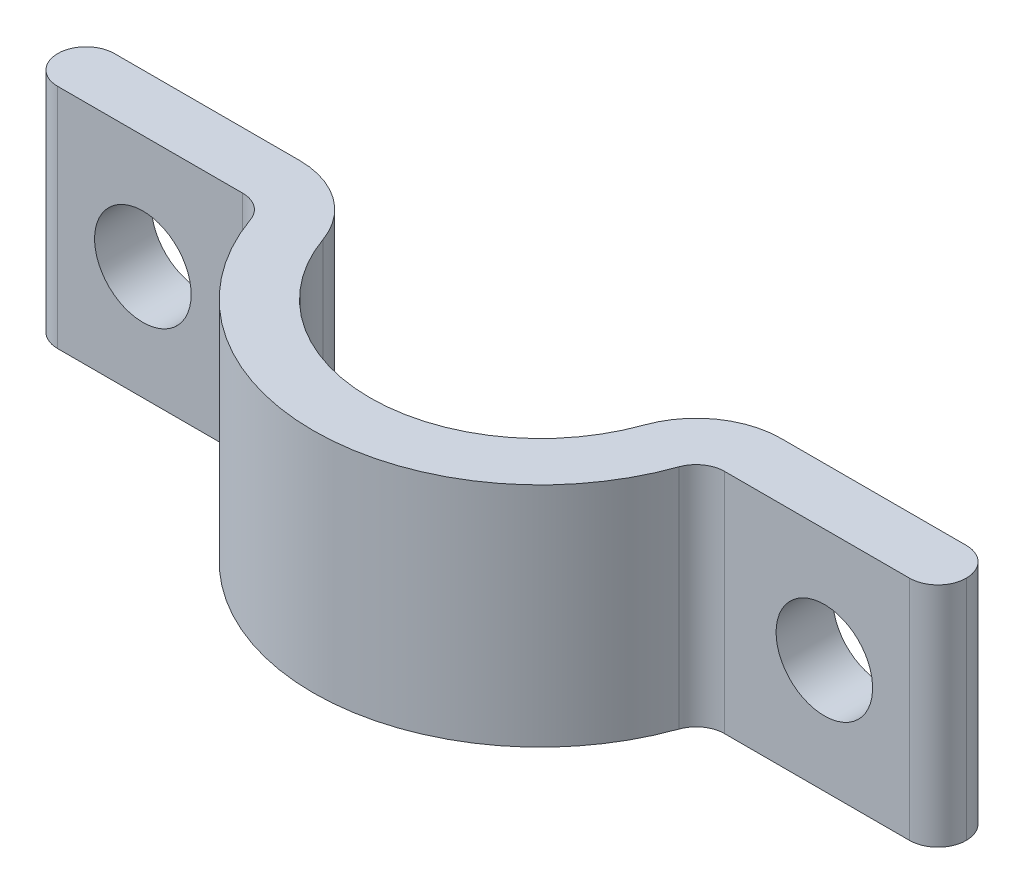
from build123d import *

# Parameters (mm, degrees)
BOSS_EXTRUDE1_DEPTH = 8
SKETCH2_R           = 1.7
CUT_EXTRUDE1_DEPTH  = 19.867962264
FILLET1_R           = 1


with BuildPart() as part:
    # Sketch1 → Boss-Extrude1 (new body)
    with BuildSketch(Plane(origin=(0, 0, 0), x_dir=(1, 0, 0), z_dir=(0, 1, 0))):
        with BuildLine():
            Line((-16, 0), (-8.485281374, 0))
            ThreePointArc((-8.485281374, 0), (-6.753230567, -0.550510257), (-5.656854249, -2))
            ThreePointArc((-5.656854249, -2), (-3.464101615, -4.898979486), (0, -6))
            Line((0, -6), (0, -8))
            ThreePointArc((0, -8), (-4.618802154, -6.531972647), (-7.542472333, -2.666666667))
            ThreePointArc((-7.542472333, -2.666666667), (-7.907931105, -2.183503419), (-8.485281374, -2))
            Line((-8.485281374, -2), (-16, -2))
            Line((-16, -2), (-16, 0))
        make_face()
    extrude(amount=BOSS_EXTRUDE1_DEPTH)

    # Sketch2 → Cut-Extrude1 (cut, through all)
    with BuildSketch(Plane.XY.offset(2)):
        with Locations((-12, 4)):
            Circle(SKETCH2_R)
    extrude(amount=-CUT_EXTRUDE1_DEPTH, mode=Mode.SUBTRACT)

    # Fillet1
    fillet1_edges = [part.edges().sort_by_distance(p)[0] for p in [
        (-16, 4, 0),
        (-16, 4, 2),
    ]]
    fillet(fillet1_edges, radius=FILLET1_R - 0.0001)  # a hair under: the kernel refuses the full size

    # Mirror1: part across plane


with BuildPart() as part_1:
    add(part.part)
    add(part.part.mirror(Plane(origin=(0, 8, 6), x_dir=(0, 0, 1), z_dir=(-1, 0, 0))))


solid = part_1.part
